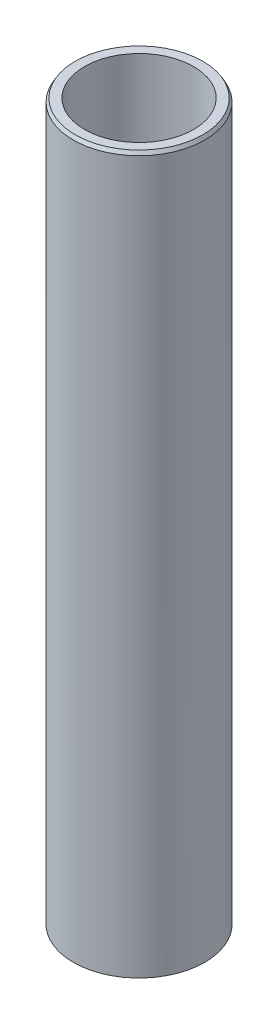
from build123d import *
from OCP.BRepFilletAPI import BRepFilletAPI_MakeChamfer

# Parameters (mm, degrees)
SKETCH1_R           = 55
BOSS_EXTRUDE1_DEPTH = 600
SKETCH2_R           = 45.613011169
CUT_EXTRUDE1_DEPTH  = 606.020660804
CHAMFER1_SIZE       = 2.921875833
CHAMFER1_SIZE2      = 1.686945798


with BuildPart() as part:
    # Sketch1 → Boss-Extrude1 (new body)
    with BuildSketch(Plane(origin=(0, 0, 0), x_dir=(1, 0, 0), z_dir=(0, 1, 0))):
        Circle(SKETCH1_R)
    extrude(amount=BOSS_EXTRUDE1_DEPTH)

    # Sketch2 → Cut-Extrude1 (cut, through all)
    with BuildSketch(Plane(origin=(0, 0, 0), x_dir=(1, 0, 0), z_dir=(0, 1, 0))):
        Circle(SKETCH2_R)
    extrude(amount=CUT_EXTRUDE1_DEPTH, mode=Mode.SUBTRACT)

    # Chamfer1: one chamfer whose edges measure the first distance from different faces: ONE call of the kernel's chamfer builder (chamfer() names one face for all edges)
    chamfer1_edges_1 = [part.edges().sort_by_distance(p)[0] for p in [
        (-55, 600, 0),
    ]]
    chamfer1_side_1 = [part.faces().sort_by_distance(p)[0] for p in [
        (-55, 300, 0),
    ]]
    chamfer1_edges_2 = [part.edges().sort_by_distance(p)[0] for p in [
        (-55, 0, 0),
    ]]
    chamfer1_side_2 = [part.faces().sort_by_distance(p)[0] for p in [
        (-53.444365081, 0, 0),
    ]]
    chamfer1 = BRepFilletAPI_MakeChamfer(part.part.solid().wrapped)
    for e in chamfer1_edges_1:
        chamfer1.Add(CHAMFER1_SIZE, CHAMFER1_SIZE2, e.wrapped, chamfer1_side_1[0].wrapped)  # the first distance lies on this face
    for e in chamfer1_edges_2:
        chamfer1.Add(CHAMFER1_SIZE, CHAMFER1_SIZE2, e.wrapped, chamfer1_side_2[0].wrapped)  # the first distance lies on this face
    add(Compound.cast(chamfer1.Shape()), mode=Mode.REPLACE)


solid = part.part
